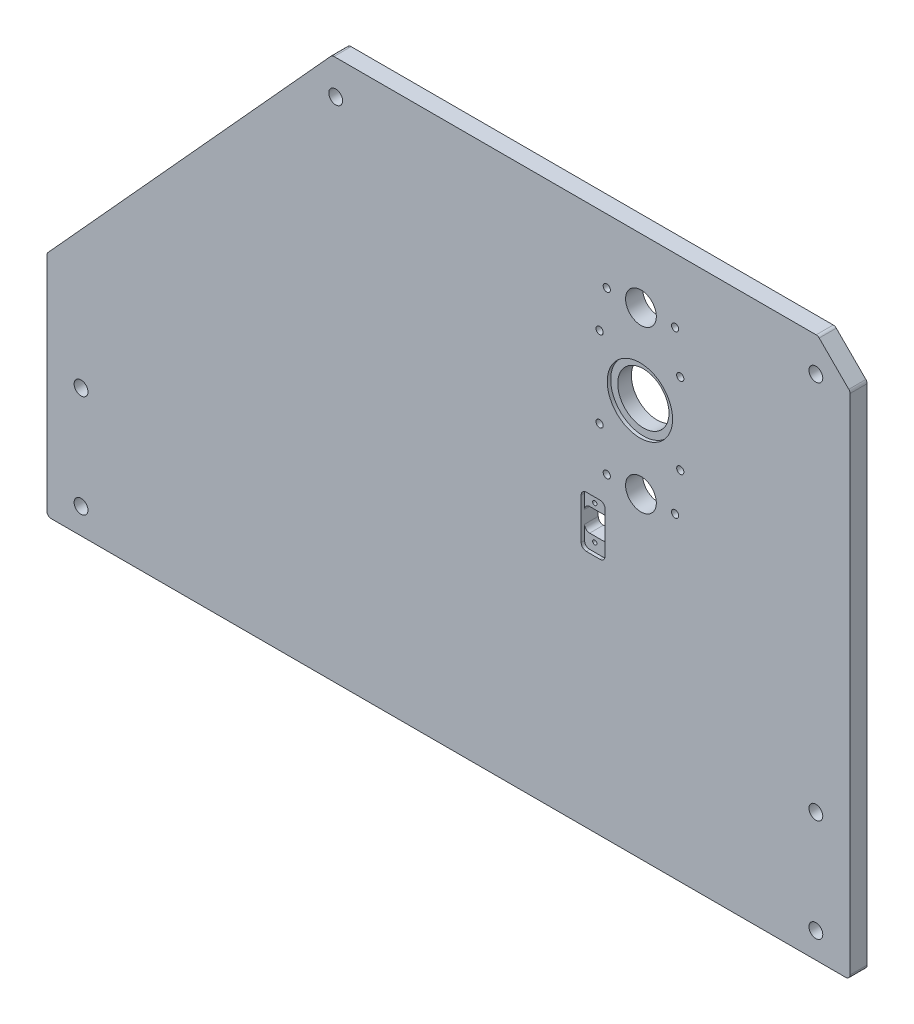
from build123d import *

# Parameters (mm, degrees)
SKETCH2_W             = 470
SKETCH2_H             = 317
BOSS_EXTRUDE1_DEPTH   = 5
SKETCH3_R             = 4.05
CUT_EXTRUDE1_DEPTH    = 10
SKETCH4_R             = 9
CUT_EXTRUDE2_DEPTH    = 284.632244288
M5X0_8_TAPPED_HOLE1_D = 4.2
SKETCH7_R             = 19.1
CUT_EXTRUDE5_DEPTH    = 2
M5X0_8_TAPPED_HOLE2_D = 4.2
SKETCH19_R            = 15
CUT_EXTRUDE10_DEPTH   = 284.568774727
SKETCH20_W            = 14
SKETCH20_H            = 30
CUT_EXTRUDE11_DEPTH   = 2
M3X0_5_TAPPED_HOLE2_D = 2.5
SKETCH23_W            = 14
SKETCH23_H            = 13.5
CUT_EXTRUDE13_DEPTH   = 284.568774727
FILLET1_R             = 3
FILLET2_R             = 2.5
CUT_EXTRUDE14_DEPTH   = 284.632244288
FILLET3_R             = 2.5


with BuildPart() as part:
    # Sketch2 → Boss-Extrude1 (new, symmetric)
    with BuildSketch(Plane.XY):
        Rectangle(SKETCH2_W, SKETCH2_H)
    extrude(amount=BOSS_EXTRUDE1_DEPTH, both=True)

    # Sketch3 → Cut-Extrude1 (cut)
    with BuildSketch(Plane.XY.offset(5)):
        with Locations((-215, -83.5)):
            Circle(SKETCH3_R)
        with Locations((-215, -143.5)):
            Circle(SKETCH3_R)
        with Locations((215, -83.5)):
            Circle(SKETCH3_R)
        with Locations((215, -143.5)):
            Circle(SKETCH3_R)
        with Locations((-66, 138.5)):
            Circle(SKETCH3_R)
        with Locations((215, 138.5)):
            Circle(SKETCH3_R)
    extrude(amount=-CUT_EXTRUDE1_DEPTH, mode=Mode.SUBTRACT)

    # Sketch4 → Cut-Extrude2 (cut, through all)
    with BuildSketch(Plane.XY.offset(5)):
        with Locations((112.65, 121)):
            Circle(SKETCH4_R)
        with Locations((112.65, 26.5)):
            Circle(SKETCH4_R)
    extrude(amount=-CUT_EXTRUDE2_DEPTH, mode=Mode.SUBTRACT)

    # M5x0.8 Tapped Hole1 (through all)
    with Locations(Plane.XY.offset(5)):
        with Locations((132.65, 121), (92.65, 121), (92.65, 26.5), (132.65, 26.5)):
            Hole(M5X0_8_TAPPED_HOLE1_D / 2)

    # Sketch7 → Cut-Extrude5 (cut)
    with BuildSketch(Plane.XY.offset(5)):
        with Locations((112.05, 73.75)):
            Circle(SKETCH7_R)
    extrude(amount=-CUT_EXTRUDE5_DEPTH, mode=Mode.SUBTRACT)

    # M5x0.8 Tapped Hole2 (through all)
    with Locations(Plane.XY.offset(5)):
        with Locations((88.45, 97.35), (135.65, 97.35), (135.65, 50.15), (88.45, 50.15)):
            Hole(M5X0_8_TAPPED_HOLE2_D / 2)

    # Sketch19 → Cut-Extrude10 (cut, through all)
    with BuildSketch(Plane.XY.offset(3)):
        with Locations((112.05, 73.75)):
            Circle(SKETCH19_R)
    extrude(amount=-CUT_EXTRUDE10_DEPTH, mode=Mode.SUBTRACT)

    # Sketch20 → Cut-Extrude11 (cut)
    with BuildSketch(Plane.XY.offset(5)):
        with Locations((84.65, -3.5)):
            Rectangle(SKETCH20_W, SKETCH20_H)
    extrude(amount=-CUT_EXTRUDE11_DEPTH, mode=Mode.SUBTRACT)

    # M3x0.5 Tapped Hole2 (through all)
    with Locations(Plane.XY.offset(3)):
        with Locations((83.65, 6.5), (83.65, -13.5)):
            Hole(M3X0_5_TAPPED_HOLE2_D / 2)

    # Sketch23 → Cut-Extrude13 (cut, through all)
    with BuildSketch(Plane.XY.offset(3)):
        with Locations((84.65, -3.5)):
            Rectangle(SKETCH23_W, SKETCH23_H)
    extrude(amount=-CUT_EXTRUDE13_DEPTH, mode=Mode.SUBTRACT)

    # Fillet1
    fillet1_edges = [part.edges().sort_by_distance(p)[0] for p in [
        (91.65, -18.5, 4),
        (77.65, -18.5, 4),
        (77.65, 11.5, 4),
        (91.65, 11.5, 4),
        (77.65, -10.25, -1),
        (77.65, 3.25, -1),
        (91.65, 3.25, -1),
        (91.65, -10.25, -1),
    ]]
    fillet(fillet1_edges, radius=FILLET1_R)

    # Fillet2
    fillet2_edges = [part.edges().sort_by_distance(p)[0] for p in [
        (-235, -158.5, 0),
        (235, -158.5, 0),
        (235, 158.5, 0),
        (-235, 158.5, 0),
    ]]
    fillet(fillet2_edges, radius=FILLET2_R)

    # Sketch26 → Cut-Extrude14 (cut, through all)
    with BuildSketch(Plane.XY.offset(5)):
        Polygon((182.649467527, 192.063735909), (267.095287826, 107.61791561), (295.419109777, 135.94173756), (210.973289478, 220.387557859), align=None)
        Polygon((-37.197655418, 192.515548017), (-280.209881526, -75.0041443), (-280.209881526, 249.003513691), align=None)
    extrude(amount=-CUT_EXTRUDE14_DEPTH, mode=Mode.SUBTRACT)

    # Fillet3
    fillet3_edges = [part.edges().sort_by_distance(p)[0] for p in [
        (-235, -25.234905158, 0),
        (216.213203436, 158.5, 0),
        (235, 139.713203436, 0),
        (-68.09704071, 158.5, 0),
    ]]
    fillet(fillet3_edges, radius=FILLET3_R)


solid = part.part
